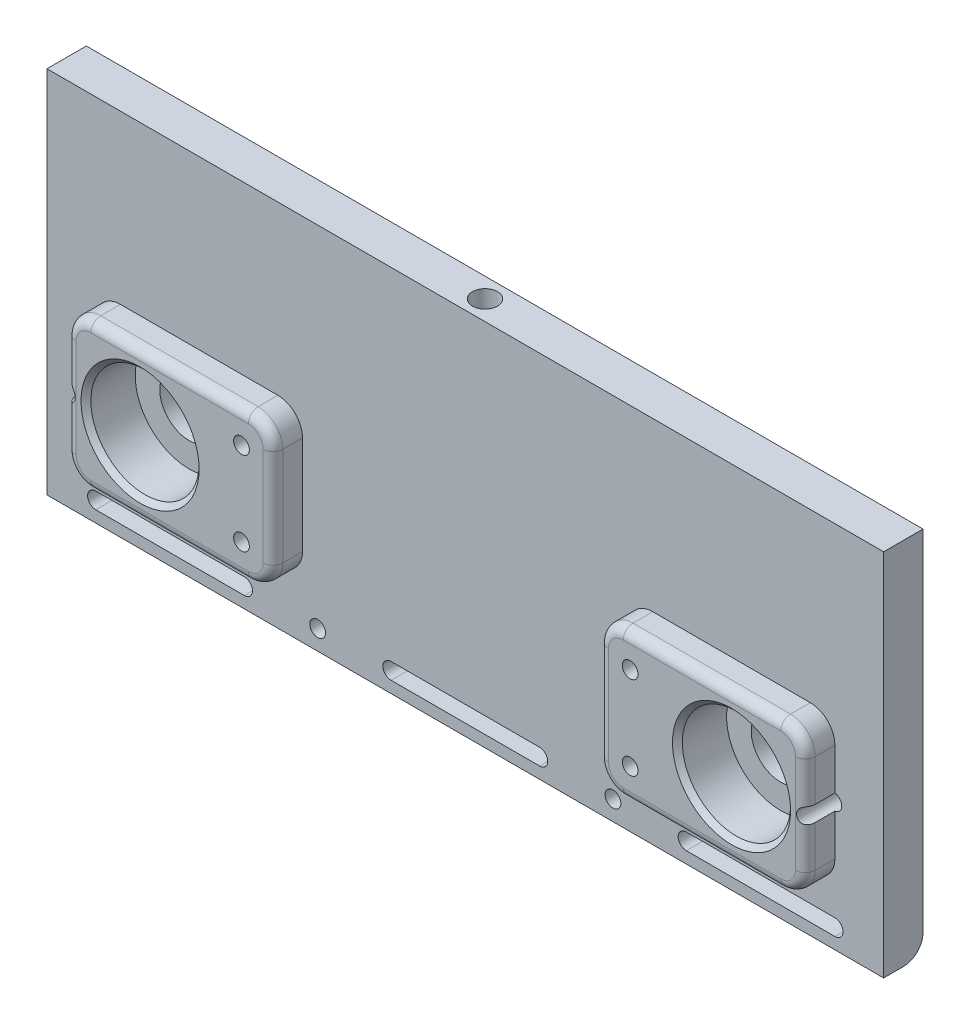
from build123d import *

# Parameters (mm, degrees)
IZIM1_W                     = 170
IZIM1_H                     = 75
Y_KSEKLIK_EKSTR_ZYON1_DEPTH = 4
KES_EKSTR_ZYON1_DEPTH       = 93.990590922
IZIM3_R                     = 1.6
KES_EKSTR_ZYON2_DEPTH       = 5
IZIM4_R                     = 3.4
KES_EKSTR_ZYON3_DEPTH       = 2.7
RADYUS1_R                   = 4
IZIM5_R                     = 2.55
KES_EKSTR_ZYON4_DEPTH       = 12
IZIM7_R                     = 11
KES_EKSTR_ZYON5_DEPTH       = 4
IZIM6_R                     = 6
KES_EKSTR_ZYON6_DEPTH       = 7.5
Y_KSEKLIK_EKSTR_ZYON2_START = 6
IZIM8_W                     = 42
IZIM8_H                     = 30
IZIM8_R                     = 11
IZIM8_R_2                   = 1.6
Y_KSEKLIK_EKSTR_ZYON2_DEPTH = 6
IZIM9_R                     = 1.6
KES_EKSTR_ZYON7_DEPTH       = 94.248324522
RADYUS2_R                   = 5
IZIM10_R                    = 1.6
KES_EKSTR_ZYON8_DEPTH       = 15
IZIM11_R                    = 3.4
KES_EKSTR_ZYON9_DEPTH       = 3
RADYUS3_R                   = 2
PAH1_SIZE                   = 1


with BuildPart() as part:
    # Çizim1 → Yükseklik-Ekstrüzyon1 (new, symmetric)
    with BuildSketch(Plane.XY):
        Rectangle(IZIM1_W, IZIM1_H)
    extrude(amount=Y_KSEKLIK_EKSTR_ZYON1_DEPTH, both=True)

    # Çizim2 → Kes-Ekstrüzyon1 (cut, through all)
    with BuildSketch(Plane.XY):
        with BuildLine():
            Line((-15.1, -31.85), (15.1, -31.85))
            ThreePointArc((15.1, -31.85), (16.75, -33.5), (15.1, -35.15))
            Line((15.1, -35.15), (-15.1, -35.15))
            ThreePointArc((-15.1, -35.15), (-16.75, -33.5), (-15.1, -31.85))
        make_face()
        with BuildLine():
            Line((-75.1, -31.85), (-44.9, -31.85))
            ThreePointArc((-44.9, -31.85), (-43.25, -33.5), (-44.9, -35.15))
            Line((-44.9, -35.15), (-75.1, -35.15))
            ThreePointArc((-75.1, -35.15), (-76.75, -33.5), (-75.1, -31.85))
        make_face()
        with BuildLine():
            Line((44.9, -31.85), (75.1, -31.85))
            ThreePointArc((75.1, -31.85), (76.75, -33.5), (75.1, -35.15))
            Line((75.1, -35.15), (44.9, -35.15))
            ThreePointArc((44.9, -35.15), (43.25, -33.5), (44.9, -31.85))
        make_face()
    extrude(amount=KES_EKSTR_ZYON1_DEPTH, mode=Mode.SUBTRACT)

    # Çizim3 → Kes-Ekstrüzyon2 (cut, symmetric)
    with BuildSketch(Plane.XY):
        with Locations((30, -33.5)):
            Circle(IZIM3_R)
        with Locations((-30, -33.5)):
            Circle(IZIM3_R)
    extrude(amount=KES_EKSTR_ZYON2_DEPTH, both=True, mode=Mode.SUBTRACT)

    # Çizim4 → Kes-Ekstrüzyon3 (cut)
    with BuildSketch(Plane(origin=(0, 0, -4), x_dir=(-1, 0, 0), z_dir=(0, 0, -1))):
        with Locations((-30, -33.5)):
            Circle(IZIM4_R)
        with Locations((30, -33.5)):
            Circle(IZIM4_R)
    extrude(amount=-KES_EKSTR_ZYON3_DEPTH, mode=Mode.SUBTRACT)

    # Radyus1
    # the kernel refuses this fillet: 4 mm, written as the material it takes off along each edge
    with BuildSketch(Plane(origin=(95, -37.5, -4), x_dir=(0, 1, 0), z_dir=(-1, 0, 0))) as radyus1_piece_1:
        with BuildLine():
            CenterArc((RADYUS1_R, -RADYUS1_R), RADYUS1_R, 90, 90)
            Line((0, -RADYUS1_R), (0, 0))
            Line((0, 0), (RADYUS1_R, 0))
        make_face()
    extrude(amount=190, mode=Mode.SUBTRACT)

    # Çizim5 → Kes-Ekstrüzyon4 (cut)
    with BuildSketch(Plane(origin=(0, 37.5, 0), x_dir=(1, 0, 0), z_dir=(0, 1, 0))):
        with Locations(Location((0, 0, 0), (0, 0, 270))):
            Circle(IZIM5_R)
    extrude(amount=-KES_EKSTR_ZYON4_DEPTH, mode=Mode.SUBTRACT)

    # Çizim7 → Kes-Ekstrüzyon5 (cut)
    with BuildSketch(Plane.XY.offset(4)):
        with Locations((-60.08, -11.5)):
            Circle(IZIM7_R)
        with Locations((60.09, -11.5)):
            Circle(IZIM7_R)
    extrude(amount=-KES_EKSTR_ZYON5_DEPTH, mode=Mode.SUBTRACT)

    # Çizim6 → Kes-Ekstrüzyon6 (cut, symmetric)
    with BuildSketch(Plane.XY):
        with Locations((60.09, -11.5)):
            Circle(IZIM6_R)
        with Locations((-60.08, -11.5)):
            Circle(IZIM6_R)
    extrude(amount=KES_EKSTR_ZYON6_DEPTH, both=True, mode=Mode.SUBTRACT)

    # Çizim8 → Yükseklik-Ekstrüzyon2 (add)
    # profile 1 of 2: a face of its own
    with BuildSketch(Plane.XY.offset(4).offset(Y_KSEKLIK_EKSTR_ZYON2_START)):
        with Locations((-54.08, -11.5)):
            Rectangle(IZIM8_W, IZIM8_H)
        with Locations((-60.08, -11.5)):
            Circle(IZIM8_R, mode=Mode.SUBTRACT)
        with Locations((-39.48, -3)):
            Circle(IZIM8_R_2, mode=Mode.SUBTRACT)
        with Locations((-39.48, -20)):
            Circle(IZIM8_R_2, mode=Mode.SUBTRACT)
    # profile 2 of 2: a face of its own
    with BuildSketch(Plane.XY.offset(4).offset(Y_KSEKLIK_EKSTR_ZYON2_START)):
        with Locations((54.09, -11.5)):
            Rectangle(IZIM8_W, IZIM8_H)
        with Locations((60.09, -11.5)):
            Circle(IZIM8_R, mode=Mode.SUBTRACT)
        with Locations((39.49, -3)):
            Circle(IZIM8_R_2, mode=Mode.SUBTRACT)
        with Locations((39.49, -20)):
            Circle(IZIM8_R_2, mode=Mode.SUBTRACT)
    extrude(amount=-Y_KSEKLIK_EKSTR_ZYON2_DEPTH)

    # Çizim9 → Kes-Ekstrüzyon7 (cut, through all)
    with BuildSketch(Plane.XY.offset(4)):
        with Locations((-39.48, -3)):
            Circle(IZIM9_R)
        with Locations((-39.48, -20)):
            Circle(IZIM9_R)
        with Locations((39.49, -3)):
            Circle(IZIM9_R)
        with Locations((39.49, -20)):
            Circle(IZIM9_R)
    extrude(amount=-KES_EKSTR_ZYON7_DEPTH, mode=Mode.SUBTRACT)

    # Radyus2
    radyus2_edges = [part.edges().sort_by_distance(p)[0] for p in [
        (-75.08, 3.5, 7),
        (-75.08, -26.5, 7),
        (-33.08, -26.5, 7),
        (-33.08, 3.5, 7),
        (33.09, 3.5, 7),
        (33.09, -26.5, 7),
        (75.09, -26.5, 7),
        (75.09, 3.5, 7),
    ]]
    fillet(radyus2_edges, radius=RADYUS2_R)

    # Çizim10 → Kes-Ekstrüzyon8 (cut, symmetric)
    with BuildSketch(Plane.XY.offset(4)):
        with Locations((-74.88, -11.5)):
            Circle(IZIM10_R)
        with Locations((74.89, -11.5)):
            Circle(IZIM10_R)
    extrude(amount=KES_EKSTR_ZYON8_DEPTH, both=True, mode=Mode.SUBTRACT)

    # Çizim11 → Kes-Ekstrüzyon9 (cut)
    with BuildSketch(Plane(origin=(0, 0, -4), x_dir=(-1, 0, 0), z_dir=(0, 0, -1))):
        with Locations((-74.89, -11.5)):
            Circle(IZIM11_R)
        with Locations((-39.49, -3)):
            Circle(IZIM11_R)
        with Locations((-39.49, -20)):
            Circle(IZIM11_R)
        with Locations((39.48, -3)):
            Circle(IZIM11_R)
        with Locations((39.48, -20)):
            Circle(IZIM11_R)
        with Locations((74.88, -11.5)):
            Circle(IZIM11_R)
    extrude(amount=-KES_EKSTR_ZYON9_DEPTH, mode=Mode.SUBTRACT)

    # Radyus3
    # the kernel refuses this fillet: 2 mm, written as the material it takes off along each edge
    with BuildSketch(Plane(origin=(70.09, -1.5, 10), x_dir=(1, 0, 0), z_dir=(0, -1, 0))) as radyus3_piece_1:
        with BuildLine():
            CenterArc((5 - RADYUS3_R, -RADYUS3_R), RADYUS3_R, 0, 90)
            Line((5 - RADYUS3_R, 0), (5, 0))
            Line((5, 0), (5, -RADYUS3_R))
        make_face()
    revolve(axis=Axis((70.09, -1.5, 10), (0, 0, 1)), revolution_arc=90, mode=Mode.SUBTRACT)
    with BuildSketch(Plane(origin=(75.09, -8.087450787, 10), x_dir=(0, 0, -1), z_dir=(0, -1, 0)), Plane(origin=(-75.08, -14.912549213, 10), x_dir=(0, 0, -1), z_dir=(0, 1, 0)), Plane(origin=(-75.08, -21.5, 10), x_dir=(0, 0, -1), z_dir=(0, 1, 0)), Plane(origin=(75.09, -1.5, 10), x_dir=(0, 0, -1), z_dir=(0, -1, 0))) as radyus3_piece_2:
        with BuildLine():
            CenterArc((RADYUS3_R, -RADYUS3_R), RADYUS3_R, 90, 90)
            Line((0, -RADYUS3_R), (0, 0))
            Line((0, 0), (RADYUS3_R, 0))
        make_face()
    extrude(amount=13.412549213, mode=Mode.SUBTRACT)
    with BuildSketch(Plane(origin=(70.09, -21.5, 10), x_dir=(0, -1, 0), z_dir=(-1, 0, 0))) as radyus3_piece_3:
        with BuildLine():
            CenterArc((5 - RADYUS3_R, -RADYUS3_R), RADYUS3_R, 0, 90)
            Line((5 - RADYUS3_R, 0), (5, 0))
            Line((5, 0), (5, -RADYUS3_R))
        make_face()
    revolve(axis=Axis((70.09, -21.5, 10), (0, 0, 1)), revolution_arc=90, mode=Mode.SUBTRACT)
    with BuildSketch(Plane(origin=(70.09, -26.5, 10), x_dir=(0, 0, -1), z_dir=(-1, 0, 0)), Plane(origin=(-38.08, -26.5, 10), x_dir=(0, 0, -1), z_dir=(-1, 0, 0)), Plane(origin=(38.09, 3.5, 10), x_dir=(0, 0, -1), z_dir=(1, 0, 0)), Plane(origin=(-70.08, 3.5, 10), x_dir=(0, 0, -1), z_dir=(1, 0, 0))) as radyus3_piece_4:
        with BuildLine():
            CenterArc((RADYUS3_R, -RADYUS3_R), RADYUS3_R, 90, 90)
            Line((0, -RADYUS3_R), (0, 0))
            Line((0, 0), (RADYUS3_R, 0))
        make_face()
    extrude(amount=32, mode=Mode.SUBTRACT)
    with BuildSketch(Plane(origin=(38.09, -21.5, 10), x_dir=(-1, 0, 0), z_dir=(0, 1, 0))) as radyus3_piece_5:
        with BuildLine():
            CenterArc((5 - RADYUS3_R, -RADYUS3_R), RADYUS3_R, 0, 90)
            Line((5 - RADYUS3_R, 0), (5, 0))
            Line((5, 0), (5, -RADYUS3_R))
        make_face()
    revolve(axis=Axis((38.09, -21.5, 10), (0, 0, 1)), revolution_arc=90, mode=Mode.SUBTRACT)
    with BuildSketch(Plane(origin=(33.09, -21.5, 10), x_dir=(0, 0, -1), z_dir=(0, 1, 0)), Plane(origin=(-33.08, -1.5, 10), x_dir=(0, 0, -1), z_dir=(0, -1, 0))) as radyus3_piece_6:
        with BuildLine():
            CenterArc((RADYUS3_R, -RADYUS3_R), RADYUS3_R, 90, 90)
            Line((0, -RADYUS3_R), (0, 0))
            Line((0, 0), (RADYUS3_R, 0))
        make_face()
    extrude(amount=20, mode=Mode.SUBTRACT)
    with BuildSketch(Plane(origin=(38.09, -1.5, 10), x_dir=(-1, 0, 0), z_dir=(0, -1, 0))) as radyus3_piece_7:
        with BuildLine():
            CenterArc((5 - RADYUS3_R, RADYUS3_R), RADYUS3_R, 270, 90)
            Line((5 - RADYUS3_R, 0), (5, 0))
            Line((5, 0), (5, RADYUS3_R))
        make_face()
    revolve(axis=Axis((38.09, -1.5, 10), (0, 0, -1)), revolution_arc=90, mode=Mode.SUBTRACT)
    with BuildSketch(Plane(origin=(-70.08, -21.5, 10), x_dir=(-1, 0, 0), z_dir=(0, 1, 0))) as radyus3_piece_8:
        with BuildLine():
            CenterArc((5 - RADYUS3_R, -RADYUS3_R), RADYUS3_R, 0, 90)
            Line((5 - RADYUS3_R, 0), (5, 0))
            Line((5, 0), (5, -RADYUS3_R))
        make_face()
    revolve(axis=Axis((-70.08, -21.5, 10), (0, 0, 1)), revolution_arc=90, mode=Mode.SUBTRACT)
    with BuildSketch(Plane(origin=(-38.08, -21.5, 10), x_dir=(0, -1, 0), z_dir=(-1, 0, 0))) as radyus3_piece_9:
        with BuildLine():
            CenterArc((5 - RADYUS3_R, -RADYUS3_R), RADYUS3_R, 0, 90)
            Line((5 - RADYUS3_R, 0), (5, 0))
            Line((5, 0), (5, -RADYUS3_R))
        make_face()
    revolve(axis=Axis((-38.08, -21.5, 10), (0, 0, 1)), revolution_arc=90, mode=Mode.SUBTRACT)
    with BuildSketch(Plane(origin=(-38.08, -1.5, 10), x_dir=(1, 0, 0), z_dir=(0, -1, 0))) as radyus3_piece_10:
        with BuildLine():
            CenterArc((5 - RADYUS3_R, -RADYUS3_R), RADYUS3_R, 0, 90)
            Line((5 - RADYUS3_R, 0), (5, 0))
            Line((5, 0), (5, -RADYUS3_R))
        make_face()
    revolve(axis=Axis((-38.08, -1.5, 10), (0, 0, 1)), revolution_arc=90, mode=Mode.SUBTRACT)
    with BuildSketch(Plane(origin=(-70.08, -1.5, 10), x_dir=(-1, 0, 0), z_dir=(0, -1, 0))) as radyus3_piece_11:
        with BuildLine():
            CenterArc((5 - RADYUS3_R, RADYUS3_R), RADYUS3_R, 270, 90)
            Line((5 - RADYUS3_R, 0), (5, 0))
            Line((5, 0), (5, RADYUS3_R))
        make_face()
    revolve(axis=Axis((-70.08, -1.5, 10), (0, 0, -1)), revolution_arc=90, mode=Mode.SUBTRACT)

    # Pah1
    pah1_edges = [part.edges().sort_by_distance(p)[0] for p in [
        (-71.08, -11.5, 10),
        (49.09, -11.5, 10),
    ]]
    chamfer(pah1_edges, length=PAH1_SIZE)


solid = part.part
